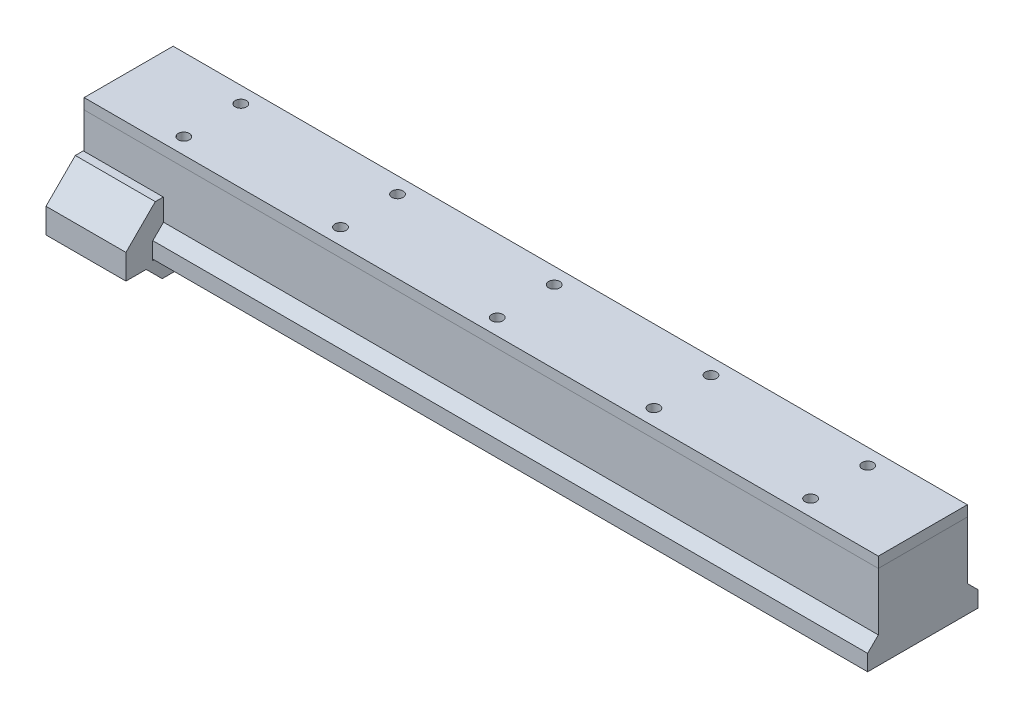
from build123d import *

# Parameters (mm, degrees)
SKETCH1_W             = 149
SKETCH1_H             = 16.7
SKETCH1_W_2           = 4.7
SKETCH1_H_2           = 4.7
BOSS_EXTRUDE1_DEPTH   = 15
SKETCH1_2_W           = 149
SKETCH1_2_H           = 16.7
BOSS_EXTRUDE2_DEPTH   = 0.8
BOSS_EXTRUDE3_DEPTH   = 149
BOSS_EXTRUDE4_DEPTH   = 15
BOSS_EXTRUDE5_DEPTH   = 3
SKETCH5_W             = 149
SKETCH5_H             = 16.7
SKETCH5_R             = 1.05
BOSS_EXTRUDE6_DEPTH   = 2
SKETCH5_2_R           = 1.05
CUT_EXTRUDE1_DEPTH    = 10
SKETCH7_R             = 1.6
CUT_EXTRUDE2_DEPTH    = 3.2
SKETCH7_4_R           = 1.5
BOSS_EXTRUDE8_DEPTH   = 3
BOSS_EXTRUDE8_2_DEPTH = 3
SKETCH7_5_R           = 2.5
SKETCH7_5_R_2         = 1.6
SKETCH7_5_R_3         = 1.5
BOSS_EXTRUDE9_DEPTH   = 1.5
BOSS_EXTRUDE10_DEPTH  = 1.5
CHAMFER1_SIZE         = 4


with BuildPart() as part:
    # Sketch1 → Boss-Extrude1 (new body)
    with BuildSketch(Plane(origin=(0, 0, 0), x_dir=(1, 0, 0), z_dir=(0, 1, 0))):
        with Locations((66.15, 0)):
            Rectangle(SKETCH1_W, SKETCH1_H)
        Rectangle(SKETCH1_W_2, SKETCH1_H_2, mode=Mode.SUBTRACT)
        with Locations((14.7, 0)):
            Rectangle(SKETCH1_W_2, SKETCH1_H_2, mode=Mode.SUBTRACT)
        with Locations((29.4, 0)):
            Rectangle(SKETCH1_W_2, SKETCH1_H_2, mode=Mode.SUBTRACT)
        with Locations((44.1, 0)):
            Rectangle(SKETCH1_W_2, SKETCH1_H_2, mode=Mode.SUBTRACT)
        with Locations((58.8, 0)):
            Rectangle(SKETCH1_W_2, SKETCH1_H_2, mode=Mode.SUBTRACT)
        with Locations((73.5, 0)):
            Rectangle(SKETCH1_W_2, SKETCH1_H_2, mode=Mode.SUBTRACT)
        with Locations((88.2, 0)):
            Rectangle(SKETCH1_W_2, SKETCH1_H_2, mode=Mode.SUBTRACT)
        with Locations((102.9, 0)):
            Rectangle(SKETCH1_W_2, SKETCH1_H_2, mode=Mode.SUBTRACT)
        with Locations((117.6, 0)):
            Rectangle(SKETCH1_W_2, SKETCH1_H_2, mode=Mode.SUBTRACT)
        with Locations((132.3, 0)):
            Rectangle(SKETCH1_W_2, SKETCH1_H_2, mode=Mode.SUBTRACT)
    extrude(amount=BOSS_EXTRUDE1_DEPTH)

    # Sketch1<2> → Boss-Extrude2 (add)
    with BuildSketch(Plane(origin=(0, 0, 0), x_dir=(1, 0, 0), z_dir=(0, 1, 0))):
        with Locations((66.15, 0)):
            Rectangle(SKETCH1_2_W, SKETCH1_2_H)
    extrude(amount=-BOSS_EXTRUDE2_DEPTH)

    # Sketch3 → Boss-Extrude3 (add)
    with BuildSketch(Plane.ZY.offset(8.35)):
        Polygon((-10.35, -0.8), (-8.35, -0.8), (-8.35, 4.2), (-10.35, 2.2), align=None)
        Polygon((10.35, 2.2), (8.35, 4.2), (8.35, -0.8), (10.35, -0.8), align=None)
    extrude(amount=-BOSS_EXTRUDE3_DEPTH)

    # Sketch5<2> → Cut-Extrude1 (cut)
    with BuildSketch(Plane(origin=(0, 15, 0), x_dir=(1, 0, 0), z_dir=(0, 1, 0))):
        with Locations(Location((7.35, 5.35, 0), (0, 0, 270))):
            Circle(SKETCH5_2_R)
        with Locations(Location((7.35, -5.35, 0), (0, 0, 270))):
            Circle(SKETCH5_2_R)
        with Locations(Location((36.75, 5.35, 0), (0, 0, 270))):
            Circle(SKETCH5_2_R)
        with Locations(Location((36.75, -5.35, 0), (0, 0, 270))):
            Circle(SKETCH5_2_R)
        with Locations(Location((66.15, 5.35, 0), (0, 0, 270))):
            Circle(SKETCH5_2_R)
        with Locations(Location((66.15, -5.35, 0), (0, 0, 270))):
            Circle(SKETCH5_2_R)
        with Locations(Location((95.55, 5.35, 0), (0, 0, 270))):
            Circle(SKETCH5_2_R)
        with Locations(Location((95.55, -5.35, 0), (0, 0, 270))):
            Circle(SKETCH5_2_R)
        with Locations(Location((124.95, 5.35, 0), (0, 0, 270))):
            Circle(SKETCH5_2_R)
        with Locations(Location((124.95, -5.35, 0), (0, 0, 270))):
            Circle(SKETCH5_2_R)
    extrude(amount=-CUT_EXTRUDE1_DEPTH, mode=Mode.SUBTRACT)


with BuildPart() as body_2:
    # Sketch3<3> → Boss-Extrude4 (new body)
    with BuildSketch(Plane.ZY.offset(8.35)):
        Polygon((-8.5, 4.262132034), (-10.5, 2.262132034), (-10.5, -0.95), (10.5, -0.95), (10.5, 2.262132034), (8.5, 4.262132034), (8.5, 8.418986284), (10, 8.418986284), (15.5, 2.918986284), (15.5, -1.75), (-15.5, -1.75), (-15.5, 2.918986284), (-10, 8.418986284), (-8.5, 8.418986284), align=None)
    extrude(amount=-BOSS_EXTRUDE4_DEPTH)

    # Sketch4 → Boss-Extrude5 (add)
    with BuildSketch(Plane.XZ.offset(1.75)):
        Polygon((-3.025, -1.7), (-3.025, 1.7), (-2.45, 1.7), (-2.45, 7.7), (-8.35, 7.7), (-8.35, -15.5), (6.65, -15.5), (6.65, 7.7), (0.75, 7.7), (0.75, 1.7), (1.325, 1.7), (1.325, -1.7), align=None)
    extrude(amount=BOSS_EXTRUDE5_DEPTH)

    # Sketch7 → Cut-Extrude2 (cut)
    with BuildSketch(Plane.XZ.offset(4.75)):
        with Locations(Location((-5.85, 0, 0), (0, 0, 270))):
            Circle(SKETCH7_R)
        with Locations(Location((4.15, 0, 0), (0, 0, 270))):
            Circle(SKETCH7_R)
    extrude(amount=-CUT_EXTRUDE2_DEPTH, mode=Mode.SUBTRACT)

    # Chamfer1
    # the kernel refuses this chamfer: 4 mm, written as the material it adds along each edge
    with BuildSketch(Plane(origin=(6.65, -1.75, 7.7), x_dir=(0, 0.027495876610586372, 0.9996219169112968), z_dir=(-1, 0, 0))) as chamfer1_piece_1_section:
        Polygon((CHAMFER1_SIZE * 0.999621916911, -CHAMFER1_SIZE * 0.0274958766106), (-CHAMFER1_SIZE * 0.0274958766106, -CHAMFER1_SIZE * 0.999621916911), (0, 0), align=None)
    chamfer1_piece_1 = extrude(amount=5.9, mode=Mode.PRIVATE)
    chamfer1_piece_1 = split(chamfer1_piece_1, bisect_by=Plane(origin=(3.7, -4.75, 9.107836441), z_dir=(0, 1, 0)), keep=Keep.TOP, mode=Mode.PRIVATE)
    add(chamfer1_piece_1)
    with BuildSketch(Plane(origin=(6.65, -1.75, 7.7), x_dir=(0, 0.027495876610586372, 0.9996219169112968), z_dir=(-1, 0, 0))) as chamfer1_piece_2_section:
        Polygon((CHAMFER1_SIZE * 0.999621916911, -CHAMFER1_SIZE * 0.0274958766106), (-CHAMFER1_SIZE * 0.0274958766106, -CHAMFER1_SIZE * 0.999621916911), (0, 0), align=None)
    chamfer1_piece_2 = extrude(amount=16.186731952, mode=Mode.PRIVATE)
    chamfer1_piece_2 = split(chamfer1_piece_2, bisect_by=Plane(origin=(-8.35, -2.89994565, 9.107836441), z_dir=(1, 0, 0)), keep=Keep.TOP, mode=Mode.PRIVATE)
    chamfer1_piece_2 = split(chamfer1_piece_2, bisect_by=Plane(origin=(-2.45, -2.89994565, 9.107836441), z_dir=(-1, 0, 0)), keep=Keep.TOP, mode=Mode.PRIVATE)
    chamfer1_piece_2 = split(chamfer1_piece_2, bisect_by=Plane(origin=(-5.4, -4.75, 9.107836441), z_dir=(0, 1, 0)), keep=Keep.TOP, mode=Mode.PRIVATE)
    add(chamfer1_piece_2)
    with BuildSketch(Plane(origin=(7.836731952, -1.75, 7.7), x_dir=(0, 0.02749587661058636, 0.9996219169112968), z_dir=(-1, 0, 0))) as chamfer1_piece_3_section:
        Polygon((CHAMFER1_SIZE * 0.999621916911, -CHAMFER1_SIZE * 0.0274958766106), (-CHAMFER1_SIZE * 0.0274958766106, -CHAMFER1_SIZE * 0.999621916911), (0, 0), align=None)
    chamfer1_piece_3 = extrude(amount=16.186731952, mode=Mode.PRIVATE)
    chamfer1_piece_3 = split(chamfer1_piece_3, bisect_by=Plane(origin=(6.65, -2.89994565, 9.107836441), z_dir=(-1, 0, 0)), keep=Keep.TOP, mode=Mode.PRIVATE)
    chamfer1_piece_3 = split(chamfer1_piece_3, bisect_by=Plane(origin=(3.7, -4.75, 9.107836441), z_dir=(0, 1, 0)), keep=Keep.TOP, mode=Mode.PRIVATE)
    chamfer1_piece_3 = split(chamfer1_piece_3, bisect_by=Plane(origin=(0.75, -2.89994565, 9.107836441), z_dir=(1, 0, 0)), keep=Keep.TOP, mode=Mode.PRIVATE)
    add(chamfer1_piece_3)
    with BuildSketch(Plane(origin=(-2.45, -1.75, 7.7), x_dir=(0, 0.027495876610586372, 0.9996219169112968), z_dir=(-1, 0, 0))) as chamfer1_piece_4_section:
        Polygon((CHAMFER1_SIZE * 0.999621916911, -CHAMFER1_SIZE * 0.0274958766106), (-CHAMFER1_SIZE * 0.0274958766106, -CHAMFER1_SIZE * 0.999621916911), (0, 0), align=None)
    chamfer1_piece_4 = extrude(amount=5.9, mode=Mode.PRIVATE)
    chamfer1_piece_4 = split(chamfer1_piece_4, bisect_by=Plane(origin=(-5.4, -4.75, 9.107836441), z_dir=(0, 1, 0)), keep=Keep.TOP, mode=Mode.PRIVATE)
    add(chamfer1_piece_4)


with BuildPart() as body_3:
    # Sketch5 → Boss-Extrude6 (new body)
    with BuildSketch(Plane(origin=(0, 15, 0), x_dir=(1, 0, 0), z_dir=(0, 1, 0))):
        with Locations((66.15, 0)):
            Rectangle(SKETCH5_W, SKETCH5_H)
        with Locations(Location((7.35, 5.35, 0), (0, 0, 270))):
            Circle(SKETCH5_R, mode=Mode.SUBTRACT)
        with Locations(Location((7.35, -5.35, 0), (0, 0, 270))):
            Circle(SKETCH5_R, mode=Mode.SUBTRACT)
        with Locations(Location((36.75, 5.35, 0), (0, 0, 270))):
            Circle(SKETCH5_R, mode=Mode.SUBTRACT)
        with Locations(Location((36.75, -5.35, 0), (0, 0, 270))):
            Circle(SKETCH5_R, mode=Mode.SUBTRACT)
        with Locations(Location((66.15, 5.35, 0), (0, 0, 270))):
            Circle(SKETCH5_R, mode=Mode.SUBTRACT)
        with Locations(Location((66.15, -5.35, 0), (0, 0, 270))):
            Circle(SKETCH5_R, mode=Mode.SUBTRACT)
        with Locations(Location((95.55, 5.35, 0), (0, 0, 270))):
            Circle(SKETCH5_R, mode=Mode.SUBTRACT)
        with Locations(Location((95.55, -5.35, 0), (0, 0, 270))):
            Circle(SKETCH5_R, mode=Mode.SUBTRACT)
        with Locations(Location((124.95, 5.35, 0), (0, 0, 270))):
            Circle(SKETCH5_R, mode=Mode.SUBTRACT)
        with Locations(Location((124.95, -5.35, 0), (0, 0, 270))):
            Circle(SKETCH5_R, mode=Mode.SUBTRACT)
    extrude(amount=BOSS_EXTRUDE6_DEPTH)


with BuildPart() as body_4:
    # Sketch7<4> → Boss-Extrude8 (new body)
    with BuildSketch(Plane.XZ.offset(4.75)):
        with Locations(Location((-5.85, 0, 0), (0, 0, 270))):
            Circle(SKETCH7_4_R)
    extrude(amount=-BOSS_EXTRUDE8_DEPTH)



with BuildPart() as body_5:
    # Sketch7<4> → Boss-Extrude8 2 (new body)
    with BuildSketch(Plane.XZ.offset(4.75)):
        with Locations(Location((4.15, 0, 0), (0, 0, 270))):
            Circle(SKETCH7_4_R)
    extrude(amount=-BOSS_EXTRUDE8_2_DEPTH)


with BuildPart() as body_4_1:
    add(body_4.part)

    add(body_5.part)  # Boss-Extrude9 merges body 5
    # Sketch7<5> → Boss-Extrude9 (add)
    # profile 1 of 8: a face of its own
    with BuildSketch(Plane.XZ.offset(4.75)):
        with Locations((-5.85, 0)):
            Circle(SKETCH7_5_R)
        with Locations(Location((-5.85, 0, 0), (0, 0, 270))):
            Circle(SKETCH7_5_R_2, mode=Mode.SUBTRACT)
    # profile 2 of 8: a face of its own
    with BuildSketch(Plane.XZ.offset(4.75)):
        Polygon((0.75, 2.5), (-2.45, 2.5), (-2.45, 1.7), (-3.025, 1.7), (-3.025, -1.7), (1.325, -1.7), (1.325, 1.7), (0.75, 1.7), align=None)
    # profile 3 of 8: a face of its own
    with BuildSketch(Plane.XZ.offset(4.75)):
        with BuildLine():
            Line((-2.45, 2.5), (-5.85, 2.5))
            ThreePointArc((-5.85, 2.5), (-4.082233047, 1.767766953), (-3.35, 0))
            ThreePointArc((-3.35, 0), (-4.082233047, -1.767766953), (-5.85, -2.5))
            Line((-5.85, -2.5), (4.15, -2.5))
            ThreePointArc((4.15, -2.5), (1.65, 0), (4.15, 2.5))
            Line((4.15, 2.5), (0.75, 2.5))
            Line((0.75, 2.5), (0.75, 1.7))
            Line((0.75, 1.7), (1.325, 1.7))
            Line((1.325, 1.7), (1.325, -1.7))
            Line((1.325, -1.7), (-3.025, -1.7))
            Line((-3.025, -1.7), (-3.025, 1.7))
            Line((-3.025, 1.7), (-2.45, 1.7))
            Line((-2.45, 1.7), (-2.45, 2.5))
        make_face()
    # profile 4 of 8: a face of its own
    with BuildSketch(Plane.XZ.offset(4.75)):
        with Locations((4.15, 0)):
            Circle(SKETCH7_5_R)
        with Locations(Location((4.15, 0, 0), (0, 0, 270))):
            Circle(SKETCH7_5_R_2, mode=Mode.SUBTRACT)
    # profile 5 of 8: a face of its own
    with BuildSketch(Plane.XZ.offset(4.75)):
        with Locations(Location((4.15, 0, 0), (0, 0, 270))):
            Circle(SKETCH7_5_R_2)
        with Locations(Location((4.15, 0, 0), (0, 0, 270))):
            Circle(SKETCH7_5_R_3, mode=Mode.SUBTRACT)
    # profile 6 of 8: a face of its own
    with BuildSketch(Plane.XZ.offset(4.75)):
        with Locations(Location((-5.85, 0, 0), (0, 0, 270))):
            Circle(SKETCH7_5_R_2)
        with Locations(Location((-5.85, 0, 0), (0, 0, 270))):
            Circle(SKETCH7_5_R_3, mode=Mode.SUBTRACT)
    # profile 7 of 8: a face of its own
    with BuildSketch(Plane.XZ.offset(4.75)):
        with Locations(Location((-5.85, 0, 0), (0, 0, 270))):
            Circle(SKETCH7_5_R_3)
    # profile 8 of 8: a face of its own
    with BuildSketch(Plane.XZ.offset(4.75)):
        with Locations(Location((4.15, 0, 0), (0, 0, 270))):
            Circle(SKETCH7_5_R_3)
    extrude(amount=BOSS_EXTRUDE9_DEPTH)

    # Sketch8 → Boss-Extrude10 (add)
    with BuildSketch(Plane(origin=(0, -4.75, 0), x_dir=(1, 0, 0), z_dir=(0, 1, 0))):
        Polygon((-2.45, -1.55), (0.75, -1.55), (1.175, -1.55), (1.175, 1.55), (-2.875, 1.55), (-2.875, -1.55), align=None)
    extrude(amount=BOSS_EXTRUDE10_DEPTH)


solid = Compound([part.part, body_2.part, body_3.part, body_4_1.part])
